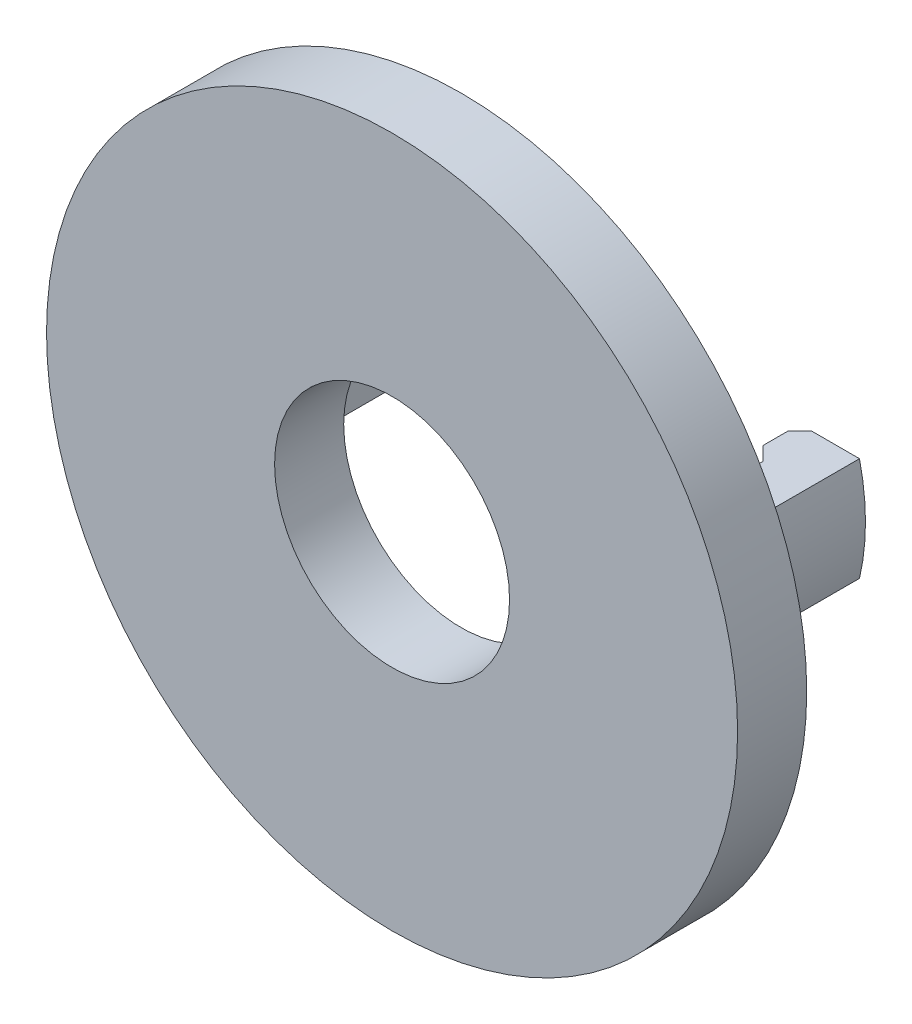
from build123d import *

# Parameters (mm, degrees)
GUARD_BASE_R           = 25
GUARD_DEPTH            = 5
INNER_AXLE_HOLE_BASE_R = 8.5
INNER_AXLE_HOLE_DEPTH  = 36.707142143
COUPLING_TOOTH_DEPTH   = 3.75
SKETCH6_4_W            = 8.5
SKETCH6_4_H            = 12.75


with BuildPart() as part:
    # Guard base → Guard (new body)
    with BuildSketch(Plane.XY):
        Circle(GUARD_BASE_R)
    extrude(amount=GUARD_DEPTH)

    # Inner axle hole base → Inner axle hole (cut, through all)
    with BuildSketch(Plane.XY.offset(5)):
        Circle(INNER_AXLE_HOLE_BASE_R)
    extrude(amount=-INNER_AXLE_HOLE_DEPTH, mode=Mode.SUBTRACT)

    # Coupling tooth base → Coupling tooth (add, symmetric)
    with BuildSketch(Plane(origin=(0, 0, 0), x_dir=(1, 0, 0), z_dir=(0, 1, 0))):
        Polygon((10.353553391, 0), (16.5, 0), (16.5, 12.75), (12.603553391, 12.75), (11.75, 11.896446609), (11.75, 10.103553391), (12.75, 9.103553391), (12.75, 2.396446609), align=None)
    coupling_tooth = extrude(amount=COUPLING_TOOTH_DEPTH, both=True)

    # Sketch6<4> → Circularity cut (revolve, cut)
    with BuildSketch(Plane(origin=(0, 0, 0), x_dir=(1, 0, 0), z_dir=(0, 1, 0))):
        with Locations((20.75, 6.375)):
            Rectangle(SKETCH6_4_W, SKETCH6_4_H)
    circularity_cut = revolve(axis=Axis((0, 0, 0), (0, 0, -1)), mode=Mode.SUBTRACT)

    # Coutpling teeth: Coupling tooth, Circularity cut across plane
    add(coupling_tooth.mirror(Plane(origin=(0, 0, 0), x_dir=(0, 0, 1), z_dir=(1, 0, 0))))
    add(circularity_cut.mirror(Plane(origin=(0, 0, 0), x_dir=(0, 0, 1), z_dir=(1, 0, 0))), mode=Mode.SUBTRACT)


solid = part.part
